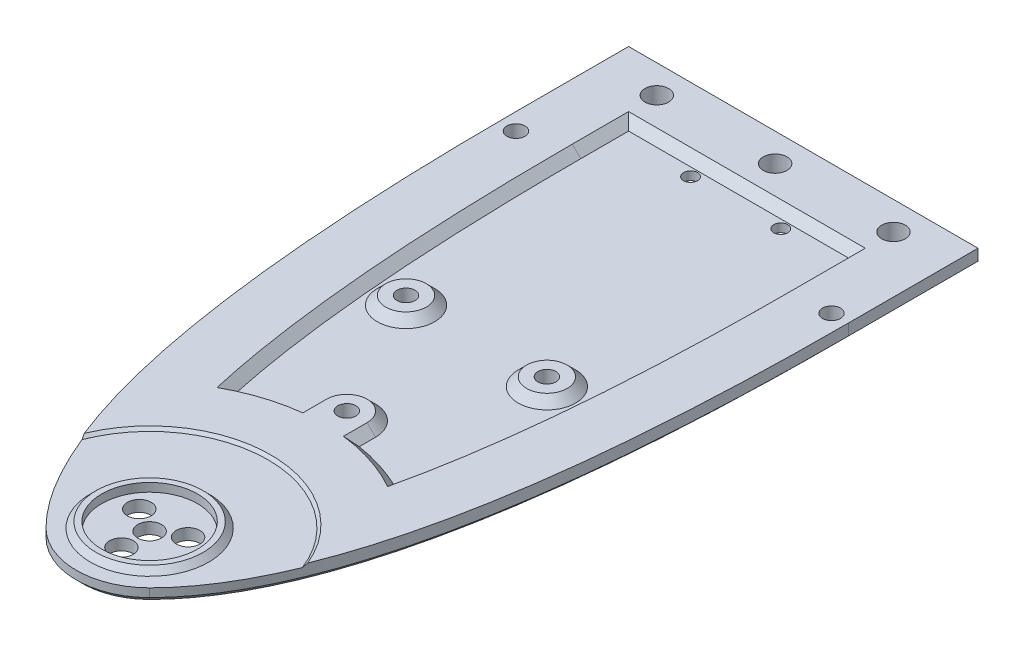
from build123d import *

# Parameters (mm, degrees)
EXTRUDE_1_OUTLINE_R   = 8.5
EXTRUDE_1_OUTLINE_R_2 = 2.1
EXTRUDE_1_DEPTH       = 3
SKETCH_2_5_R          = 8.5
SKETCH_2_5_R_2        = 2.1
EXTRUDE_3_DEPTH       = 2
SKETCH_3_R            = 1.6
CUT_EXTRUDE_1_DEPTH   = 10
SKETCH_14_R           = 21
SKETCH_14_R_2         = 11
CUT_EXTRUDE_2_DEPTH   = 0.5
SKETCH_15_R           = 9.5
SKETCH_15_R_2         = 8.5
EXTRUDE_4_DEPTH       = 0.5
SKETCH_15_3_R         = 11
SKETCH_15_3_R_2       = 9.5
CUT_EXTRUDE_3_DEPTH   = 0.5
SKETCH_17_R           = 3.6
CUT_EXTRUDE_4_DEPTH   = 1.5
HOLE_WIZARD_M3_1_D    = 2.5
CHAMFER_1_SIZE        = 0.5
CHAMFER_2_SIZE        = 1
CHAMFER_3_SIZE        = 1
CHAMFER_4_SIZE        = 1.5


# Read off the part's stored shape, not the designer's step: 凸台-拉伸1
with BuildPart() as part:
    # 凸台-拉伸1 outline → 凸台-拉伸1 (new body)
    with BuildSketch(Plane(origin=(0, 0, 0), x_dir=(1, 0, 0), z_dir=(0, 1, 0))):
        with BuildLine():
            add(Edge.make_bspline(
                [(-17.166812063, -88.021637563), (-38.974423907, -66.214025718), (-38.974423907, 17.170750592)],
                knots=[0, 0, 0, 1, 1, 1], degree=2))
            ThreePointArc((-17.166812063, -88.021637563), (-7.974423908, -91.829249408), (1.217964248, -88.021637563))
            add(Edge.make_bspline(
                [(1.217964248, -88.021637563), (23.025576093, -66.214025718), (23.025576093, 14.170750592)],
                knots=[0, 0, 0, 1, 1, 1], degree=2))
            Line((23.025576093, 14.170750592), (23.025576093, 37.170750592))
            Line((23.025576093, 37.170750592), (-38.974423907, 37.170750592))
            Line((-38.974423907, 37.170750592), (-38.974423907, 17.170750592))
        make_face()
        with Locations((-7.974423907, -78.829249408)):
            Circle(EXTRUDE_1_OUTLINE_R, mode=Mode.SUBTRACT)
        with Locations((-28.974423907, 32.170750592)):
            Circle(EXTRUDE_1_OUTLINE_R_2, mode=Mode.SUBTRACT)
        with Locations((-7.974423907, 32.170750592)):
            Circle(EXTRUDE_1_OUTLINE_R_2, mode=Mode.SUBTRACT)
        with Locations((13.025576093, 32.170750592)):
            Circle(EXTRUDE_1_OUTLINE_R_2, mode=Mode.SUBTRACT)
    extrude(amount=EXTRUDE_1_DEPTH)

    # 草图2<5> → 凸台-拉伸3 (add)
    with BuildSketch(Plane(origin=(0, 0, 0), x_dir=(1, 0, 0), z_dir=(0, 1, 0))):
        with Locations(Location((-7.974423907, -78.829249408, 0), (0, 0, 270))):
            Circle(SKETCH_2_5_R)
        with Locations(Location((-7.974423907, -78.829249408, 0), (0, 0, 270))):
            Circle(SKETCH_2_5_R_2, mode=Mode.SUBTRACT)
        with Locations(Location((-7.974423907, -83.829249408, 0), (0, 0, 270))):
            Circle(SKETCH_2_5_R_2, mode=Mode.SUBTRACT)
        with Locations(Location((-12.304550926, -76.329249408, 0), (0, 0, 270))):
            Circle(SKETCH_2_5_R_2, mode=Mode.SUBTRACT)
        with Locations(Location((-3.644296889, -76.329249408, 0), (0, 0, 270))):
            Circle(SKETCH_2_5_R_2, mode=Mode.SUBTRACT)
    extrude(amount=EXTRUDE_3_DEPTH)

    # 草图3 → 切除-拉伸1 (cut)
    with BuildSketch(Plane(origin=(0, 3, 0), x_dir=(1, 0, 0), z_dir=(0, 1, 0))):
        with Locations(Location((-20.474423907, -20.829249408, 0), (0, 0, 270))):
            Circle(SKETCH_3_R)
        with Locations(Location((-7.974423907, -43.829249408, 0), (0, 0, 270))):
            Circle(SKETCH_3_R)
        with Locations(Location((4.525576093, -20.829249408, 0), (0, 0, 270))):
            Circle(SKETCH_3_R)
        with BuildLine():
            add(Edge.make_bspline(
                [(20.023435546, 12.570751852), (20.024869664, 13.10402087), (20.025576092, 13.637354354), (20.025576093, 14.17075042)],
                knots=[0.984640038, 0.984640038, 0.984640038, 0.984640038, 1, 1, 1, 1], degree=3))
            ThreePointArc((20.023435546, 12.570751852), (21.156189892, 13.038623026), (21.625576093, 14.17075042))
            ThreePointArc((21.625576093, 14.17075042), (21.156946942, 15.30212127), (20.025576093, 15.770750421))
            Line((20.025576093, 15.770750421), (20.025576093, 14.17075042))
        make_face()
        with BuildLine():
            ThreePointArc((20.025576093, 15.770750421), (18.42557645, 14.171820694), (20.023435546, 12.570751852))
            add(Edge.make_bspline(
                [(20.023435546, 12.570751852), (20.024869664, 13.10402087), (20.025576092, 13.637354354), (20.025576093, 14.17075042)],
                knots=[0.984640038, 0.984640038, 0.984640038, 0.984640038, 1, 1, 1, 1], degree=3))
            Line((20.025576093, 14.17075042), (20.025576093, 15.770750421))
        make_face()
        with BuildLine():
            add(Edge.make_bspline(
                [(20.023435546, 12.570751852), (20.024869664, 13.10402087), (20.025576092, 13.637354354), (20.025576093, 14.17075042)],
                knots=[0.984640038, 0.984640038, 0.984640038, 0.984640038, 1, 1, 1, 1], degree=3))
            ThreePointArc((20.023435546, 12.570751852), (21.156189892, 13.038623026), (21.625576093, 14.17075042))
            ThreePointArc((21.625576093, 14.17075042), (21.156946942, 15.30212127), (20.025576093, 15.770750421))
            Line((20.025576093, 15.770750421), (20.025576093, 14.17075042))
        make_face()
        with BuildLine():
            ThreePointArc((20.025576093, 15.770750421), (18.42557645, 14.171820694), (20.023435546, 12.570751852))
            add(Edge.make_bspline(
                [(20.023435546, 12.570751852), (20.024869664, 13.10402087), (20.025576092, 13.637354354), (20.025576093, 14.17075042)],
                knots=[0.984640038, 0.984640038, 0.984640038, 0.984640038, 1, 1, 1, 1], degree=3))
            Line((20.025576093, 14.17075042), (20.025576093, 15.770750421))
        make_face()
        with BuildLine():
            add(Edge.make_bspline(
                [(-35.972904235, 15.77076657), (-35.970577924, 14.703877861), (-35.965558208, 13.637219724), (-35.95768993, 12.570805439)],
                knots=[0.013068236, 0.013068236, 0.013068236, 0.013068236, 0.042947848, 0.042947848, 0.042947848, 0.042947848], degree=3))
            ThreePointArc((-35.95768993, 12.570805439), (-34.83258585, 13.042835053), (-34.367376117, 14.17077612))
            ThreePointArc((-34.367376117, 14.17077612), (-34.837961443, 15.304099769), (-35.972904235, 15.77076657))
        make_face()
        with BuildLine():
            ThreePointArc((-35.972904235, 15.77076657), (-37.567358033, 14.163168961), (-35.95768993, 12.570805439))
            add(Edge.make_bspline(
                [(-35.972904235, 15.77076657), (-35.970577924, 14.703877861), (-35.965558208, 13.637219724), (-35.95768993, 12.570805439)],
                knots=[0.013068236, 0.013068236, 0.013068236, 0.013068236, 0.042947848, 0.042947848, 0.042947848, 0.042947848], degree=3))
        make_face()
        with BuildLine():
            add(Edge.make_bspline(
                [(-35.972904235, 15.77076657), (-35.970577924, 14.703877861), (-35.965558208, 13.637219724), (-35.95768993, 12.570805439)],
                knots=[0.013068236, 0.013068236, 0.013068236, 0.013068236, 0.042947848, 0.042947848, 0.042947848, 0.042947848], degree=3))
            ThreePointArc((-35.95768993, 12.570805439), (-34.83258585, 13.042835053), (-34.367376117, 14.17077612))
            ThreePointArc((-34.367376117, 14.17077612), (-34.837961443, 15.304099769), (-35.972904235, 15.77076657))
        make_face()
        with BuildLine():
            ThreePointArc((-35.972904235, 15.77076657), (-37.567358033, 14.163168961), (-35.95768993, 12.570805439))
            add(Edge.make_bspline(
                [(-35.972904235, 15.77076657), (-35.970577924, 14.703877861), (-35.965558208, 13.637219724), (-35.95768993, 12.570805439)],
                knots=[0.013068236, 0.013068236, 0.013068236, 0.013068236, 0.042947848, 0.042947848, 0.042947848, 0.042947848], degree=3))
        make_face()
    extrude(amount=-CUT_EXTRUDE_1_DEPTH, mode=Mode.SUBTRACT)

    # 草图14 → 切除-拉伸2 (cut)
    with BuildSketch(Plane(origin=(0, 3, 0), x_dir=(1, 0, 0), z_dir=(0, 1, 0))):
        with Locations((-7.974423907, -78.829249408)):
            Circle(SKETCH_14_R)
        with Locations(Location((-7.974423907, -78.829249408, 0), (0, 0, 270))):
            Circle(SKETCH_14_R_2, mode=Mode.SUBTRACT)
    extrude(amount=-CUT_EXTRUDE_2_DEPTH, mode=Mode.SUBTRACT)

    # 草图15 → 凸台-拉伸4 (add)
    with BuildSketch(Plane(origin=(0, 3, 0), x_dir=(1, 0, 0), z_dir=(0, 1, 0))):
        with Locations(Location((-7.974423907, -78.829249408, 0), (0, 0, 270))):
            Circle(SKETCH_15_R)
        with Locations(Location((-7.974423907, -78.829249408, 0), (0, 0, 270))):
            Circle(SKETCH_15_R_2, mode=Mode.SUBTRACT)
    extrude(amount=EXTRUDE_4_DEPTH)

    # 草图15<3> → 切除-拉伸3 (cut)
    with BuildSketch(Plane(origin=(0, 3, 0), x_dir=(1, 0, 0), z_dir=(0, 1, 0))):
        with Locations((-7.974423907, -78.829249408)):
            Circle(SKETCH_15_3_R)
        with Locations(Location((-7.974423907, -78.829249408, 0), (0, 0, 270))):
            Circle(SKETCH_15_3_R_2, mode=Mode.SUBTRACT)
    extrude(amount=-CUT_EXTRUDE_3_DEPTH, mode=Mode.SUBTRACT)

    # 草图17 → 切除-拉伸4 (cut)
    with BuildSketch(Plane(origin=(0, 3, 0), x_dir=(1, 0, 0), z_dir=(0, 1, 0))):
        with BuildLine():
            Line((13.025576092, 14.170750423), (13.025576093, 27.170750592))
            Line((13.025576093, 27.170750592), (-28.974423907, 27.170750592))
            Line((-28.974423907, 27.170750592), (-28.974423907, 17.170750593))
            add(Edge.make_bspline(
                [(-28.974423907, 17.170750593), (-28.974423907, 16.269195088), (-28.970488681, 14.457630491), (-28.946896512, 10.902181502), (-28.88796599, 6.538155004), (-28.770280907, 1.444763575), (-28.550956523, -5.159889163), (-28.160223277, -13.062582354), (-27.506634821, -21.977995121), (-26.670837795, -30.321034256), (-25.825272667, -36.792543941), (-25.061816574, -41.677735178), (-24.446278097, -45.195675053), (-23.898973623, -48.001794009), (-23.439435738, -50.177909134), (-23.205252856, -51.231040305), (-23.084316333, -51.760981078)],
                knots=[0.495137494, 0.495137494, 0.495137494, 0.495137494, 0.495204508, 0.495271522, 0.49540555, 0.495539578, 0.495673606, 0.495941662, 0.496209718, 0.496477774, 0.49674583, 0.496879858, 0.497013886, 0.497147914, 0.497214928, 0.497281942, 0.497281942, 0.497281942, 0.497281942], degree=3))
            ThreePointArc((-23.084316333, -51.760981078), (-17.512679556, -49.333119506), (-11.574423907, -48.038991208))
            Line((-11.574423907, -48.038991208), (-11.574423907, -43.829249408))
            ThreePointArc((-11.574423907, -43.829249408), (-7.974423907, -40.229249408), (-4.374423907, -43.829249408))
            Line((-4.374423907, -43.829249408), (-4.374423907, -48.038991208))
            ThreePointArc((-4.374423907, -48.038991208), (1.637972241, -49.357197587), (7.271408172, -51.837313529))
            add(Edge.make_bspline(
                [(7.271408172, -51.837313529), (7.389504317, -51.325314195), (7.618348057, -50.307521572), (8.067209845, -48.206887978), (8.601830143, -45.500866067), (9.203062297, -42.113137142), (9.948786526, -37.414536921), (10.774748665, -31.200556935), (11.591266253, -23.204861683), (12.229867449, -14.674765392), (12.611697308, -7.124589853), (12.826044583, -0.820742716), (12.941067076, 4.037728741), (12.998668332, 8.1980197), (13.021729311, 11.586194202), (13.025576092, 13.311861174), (13.025576092, 14.170750423)],
                knots=[0.502689124, 0.502689124, 0.502689124, 0.502689124, 0.502753974, 0.502818824, 0.502948525, 0.503078225, 0.503207925, 0.503467325, 0.503726726, 0.503986126, 0.504245527, 0.504375227, 0.504504927, 0.504634627, 0.504699477, 0.504764327, 0.504764327, 0.504764327, 0.504764327], degree=3))
        make_face()
        with Locations(Location((-20.474423907, -20.829249408, 0), (0, 0, 270))):
            Circle(SKETCH_17_R, mode=Mode.SUBTRACT)
        with Locations(Location((4.525576093, -20.829249408, 0), (0, 0, 270))):
            Circle(SKETCH_17_R, mode=Mode.SUBTRACT)
    extrude(amount=-CUT_EXTRUDE_4_DEPTH, mode=Mode.SUBTRACT)

    # M3 螺纹孔1 (through all)
    with Locations(Plane(origin=(-14.974423907, 0, -24.170750592), x_dir=(0, 0, -1), z_dir=(0, -1, 0))):
        with Locations((0, 0), (0, 16)):
            Hole(HOLE_WIZARD_M3_1_D / 2)

    # 倒角1
    chamfer_1_edges = [part.edges().sort_by_distance(p)[0] for p in [
        (-7.910626734, 3, 57.829346314),
    ]]
    chamfer(chamfer_1_edges, length=CHAMFER_1_SIZE - 0.0001)  # a hair under: the kernel refuses the full size

    # 倒角2
    chamfer_2_edges = [part.edges().sort_by_distance(p)[0] for p in [
        (-38.974423907, 0, -27.170750592),
        (23.025576093, 0, -25.670750592),
        (-7.974423907, 0, 91.829249408),
    ]]
    chamfer(chamfer_2_edges, length=CHAMFER_2_SIZE)

    # 倒角3
    chamfer_3_edges = [part.edges().sort_by_distance(p)[0] for p in [
        (-7.974423907, 2.5, 69.329249408),
    ]]
    chamfer(chamfer_3_edges, length=CHAMFER_3_SIZE - 0.0001)  # a hair under: the kernel refuses the full size

    # 倒角4
    chamfer_4_edges = [part.edges().sort_by_distance(p)[0] for p in [
        (1.63797224, 1.5, 49.357197586),
    ]]
    chamfer(chamfer_4_edges, length=CHAMFER_4_SIZE - 0.0001)  # a hair under: the kernel refuses the full size
    chamfer_4_2_edges = [part.edges().sort_by_distance(p)[0] for p in [
        (-4.374423907, 1.5, 45.179299717),
        (-7.974423907, 1.5, 40.229249408),
        (-11.574423907, 1.5, 45.934120308),
    ]]
    chamfer(chamfer_4_2_edges, length=CHAMFER_4_SIZE - 0.0001)  # a hair under: the kernel refuses the full size
    chamfer_4_3_edges = [part.edges().sort_by_distance(p)[0] for p in [
        (-18.230535246, 1.5, 49.574981682),
    ]]
    chamfer(chamfer_4_3_edges, length=CHAMFER_4_SIZE - 0.0001)  # a hair under: the kernel refuses the full size
    chamfer_4_4_edges = [part.edges().sort_by_distance(p)[0] for p in [
        (-27.564156138, 1.5, 20.844911084),
        (-28.974423907, 1.5, -22.170750592),
    ]]
    chamfer(chamfer_4_4_edges, length=CHAMFER_4_SIZE - 0.0001)  # a hair under: the kernel refuses the full size
    chamfer_4_5_edges = [part.edges().sort_by_distance(p)[0] for p in [
        (-7.224473907, 1.5, -27.170750592),
    ]]
    chamfer(chamfer_4_5_edges, length=CHAMFER_4_SIZE - 0.0001)  # a hair under: the kernel refuses the full size
    chamfer_4_6_edges = [part.edges().sort_by_distance(p)[0] for p in [
        (13.025576092, 1.5, -19.920800508),
        (11.65044724, 1.5, 22.087266152),
    ]]
    chamfer(chamfer_4_6_edges, length=CHAMFER_4_SIZE - 0.0001)  # a hair under: the kernel refuses the full size
    chamfer_4_7_edges = [part.edges().sort_by_distance(p)[0] for p in [
        (-20.474423907, 1.5, 17.229249408),
    ]]
    chamfer(chamfer_4_7_edges, length=CHAMFER_4_SIZE - 0.0001)  # a hair under: the kernel refuses the full size
    chamfer_4_8_edges = [part.edges().sort_by_distance(p)[0] for p in [
        (4.525576093, 1.5, 17.229249408),
    ]]
    chamfer(chamfer_4_8_edges, length=CHAMFER_4_SIZE - 0.0001)  # a hair under: the kernel refuses the full size


solid = part.part
